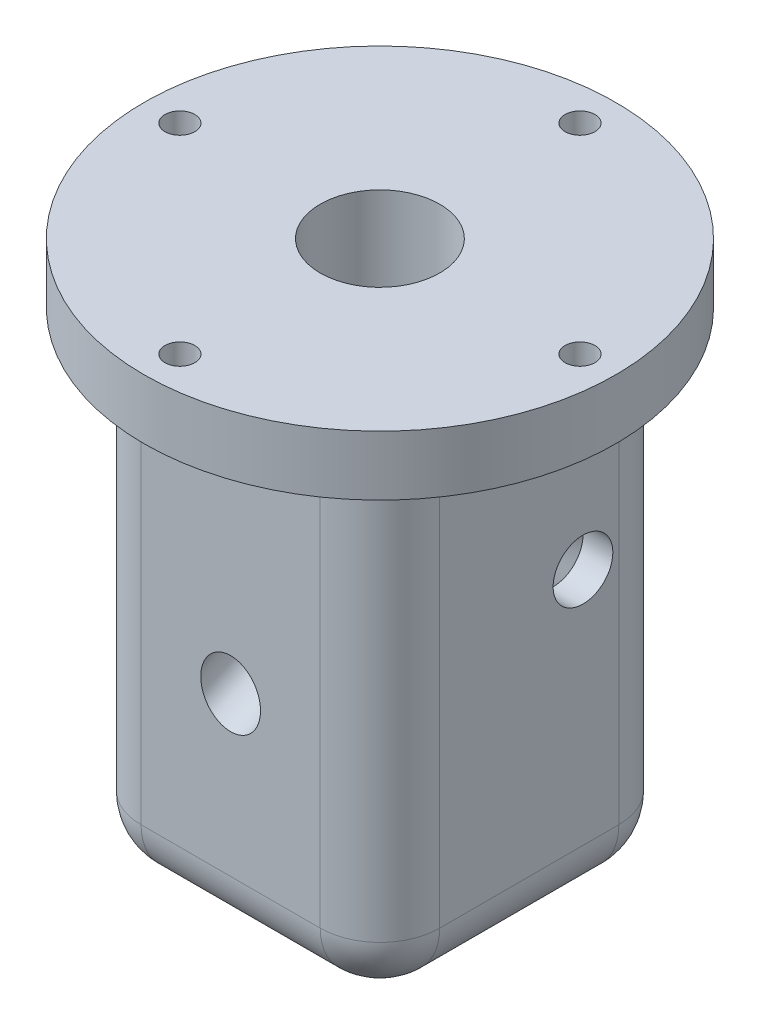
from build123d import *

# Parameters (mm, degrees)
SKETCH1_W                        = 31.75
SKETCH1_H                        = 31.75
STOCK_DEPTH                      = 50.8
SP_TAP_D                         = 12.7
SP_TAP_DEPTH                     = 33.02
SP_TAP_TIP                       = 3.815464931
F_47_START                       = -7.737817178
F_47_0_0785_GOX_ORFICE_OUTLINE_R = 0.99695
F_47_0_0785_GOX_ORFICE_DEPTH     = 11.439445718
F_65_0_035_DIAMETER_HOLE2_REACH  = 63.974
F_65_0_035_DIAMETER_HOLE2_BORE_R = 0.4445
SKETCH25_W                       = 31.75
SKETCH25_H                       = 31.75
BOSS_EXTRUDE1_DEPTH              = 6.35
M14_TAPPED_HOLE1_D               = 12
M14_TAPPED_HOLE1_DEPTH           = 19.05
M14_TAPPED_HOLE1_CSINK_D         = 14.05
M14_TAPPED_HOLE1_CSINK_ANGLE     = 90
M14_TAPPED_HOLE1_TIP             = 3.605163714
SKETCH30_R                       = 6.0198
CUT_EXTRUDE1_DEPTH               = 62.401577893
SKETCH31_R                       = 25.0825
SKETCH31_R_2                     = 1.5875
SKETCH31_W                       = 31.75
SKETCH31_H                       = 31.75
BOSS_EXTRUDE2_DEPTH              = 6.35
F_1_4_0_25_DIAMETER_HOLE1_D      = 6.35
F_1_4_0_25_DIAMETER_HOLE1_DEPTH  = 3.175
F_1_4_0_25_DIAMETER_HOLE1_TIP    = 1.907732465
FILLET2_R                        = 6.35
FILLET3_R                        = 6.35
FILLET4_R                        = 1.5875


# Read off the part's stored shape, not the designer's step: #47 (0.0785) GOx Orfice
with BuildPart() as part:
    # Sketch1 → Stock (new body)
    with BuildSketch(Plane(origin=(0, 0, 0), x_dir=(1, 0, 0), z_dir=(0, 1, 0))):
        Rectangle(SKETCH1_W, SKETCH1_H)
    extrude(amount=STOCK_DEPTH)

    # SP TAP
    with Locations(Plane(origin=(0, 50.8, 0), x_dir=(1, 0, 0), z_dir=(0, 1, 0))):
        with Locations((0, 0)):
            Hole(SP_TAP_D / 2, depth=SP_TAP_DEPTH)
            with Locations((0, 0, -(SP_TAP_DEPTH + SP_TAP_TIP / 2))):  # 118° drill point
                Cone(0, SP_TAP_D / 2, SP_TAP_TIP, mode=Mode.SUBTRACT)

    # #47 (0.0785) GOx Orfice outline → #47 (0.0785) GOx Orfice (cut)
    with BuildSketch(Plane(origin=(0, 0, 0), x_dir=(1, 0, 0), z_dir=(0, 0.42261826174069705, 0.9063077870366512)).offset(F_47_START)):
        with Locations((0, 21.96659786)):
            Circle(F_47_0_0785_GOX_ORFICE_OUTLINE_R)
    f_47_0_0785_gox_orfice = extrude(amount=F_47_0_0785_GOX_ORFICE_DEPTH, mode=Mode.SUBTRACT)

    # Second GOx Orfice: #47 (0.0785) GOx Orfice across plane
    add(f_47_0_0785_gox_orfice.mirror(Plane.XY), mode=Mode.SUBTRACT)

    # #65 (0.035) Diameter Hole2 bore → #65 (0.035) Diameter Hole2 (cut, up to next)
    with BuildSketch(Plane(origin=(15.875, 0, 0), x_dir=(0, 0, -1), z_dir=(1, 0, 0)), mode=Mode.PRIVATE) as f_65_0_035_diameter_hole2_sk1:
        with Locations((5.715, 25.4)):
            Circle(F_65_0_035_DIAMETER_HOLE2_BORE_R)
    f_65_0_035_diameter_hole2_tool1 = extrude(f_65_0_035_diameter_hole2_sk1.sketch, amount=-F_65_0_035_DIAMETER_HOLE2_REACH, mode=Mode.PRIVATE) & part.part
    add(f_65_0_035_diameter_hole2_tool1.solids().sort_by_distance((15.875, 25.4, -5.715))[0], mode=Mode.SUBTRACT)

    # Sketch25 → Boss-Extrude1 (add)
    with BuildSketch(Plane(origin=(0, 0, 0), x_dir=(-1, 0, 0), z_dir=(0, -1, 0))):
        Rectangle(SKETCH25_W, SKETCH25_H)
    extrude(amount=BOSS_EXTRUDE1_DEPTH)

    # M14 Tapped Hole1
    with Locations(Plane(origin=(0, -6.35, 0), x_dir=(-1, 0, 0), z_dir=(0, -1, 0))):
        with Locations((0, 0)):
            CounterSinkHole(M14_TAPPED_HOLE1_D / 2, M14_TAPPED_HOLE1_CSINK_D / 2, depth=M14_TAPPED_HOLE1_DEPTH, counter_sink_angle=M14_TAPPED_HOLE1_CSINK_ANGLE)
            with Locations((0, 0, -(M14_TAPPED_HOLE1_DEPTH + M14_TAPPED_HOLE1_TIP / 2))):  # 118° drill point
                Cone(0, M14_TAPPED_HOLE1_D / 2, M14_TAPPED_HOLE1_TIP, mode=Mode.SUBTRACT)

    # Sketch30 → Cut-Extrude1 (cut, through all)
    with BuildSketch(Plane(origin=(0, -6.35, 0), x_dir=(-1, 0, 0), z_dir=(0, -1, 0))):
        with Locations(Location((0, 0, 0), (0, 0, 90))):
            Circle(SKETCH30_R)
    extrude(amount=-CUT_EXTRUDE1_DEPTH, mode=Mode.SUBTRACT)

    # Sketch31 → Boss-Extrude2 (add)
    with BuildSketch(Plane(origin=(0, 50.8, 0), x_dir=(1, 0, 0), z_dir=(0, 1, 0))):
        with Locations(Location((0, 0, 0), (0, 0, 270))):
            Circle(SKETCH31_R)
        with Locations(Location((21.2725, 0, 0), (0, 0, 270))):
            Circle(SKETCH31_R_2, mode=Mode.SUBTRACT)
        with Locations(Location((0, -21.2725, 0), (0, 0, 270))):
            Circle(SKETCH31_R_2, mode=Mode.SUBTRACT)
        with Locations(Location((-21.2725, 0, 0), (0, 0, 270))):
            Circle(SKETCH31_R_2, mode=Mode.SUBTRACT)
        with Locations(Location((0, 21.2725, 0), (0, 0, 270))):
            Circle(SKETCH31_R_2, mode=Mode.SUBTRACT)
        Rectangle(SKETCH31_W, SKETCH31_H, mode=Mode.SUBTRACT)
    extrude(amount=-BOSS_EXTRUDE2_DEPTH)

    # 1/4 (0.25) Diameter Hole1
    with Locations(Plane(origin=(15.875, 0, 0), x_dir=(0, 0, -1), z_dir=(1, 0, 0))):
        with Locations((5.715, 25.4)):
            Hole(F_1_4_0_25_DIAMETER_HOLE1_D / 2, depth=F_1_4_0_25_DIAMETER_HOLE1_DEPTH)
            with Locations((0, 0, -(F_1_4_0_25_DIAMETER_HOLE1_DEPTH + F_1_4_0_25_DIAMETER_HOLE1_TIP / 2))):  # 118° drill point
                Cone(0, F_1_4_0_25_DIAMETER_HOLE1_D / 2, F_1_4_0_25_DIAMETER_HOLE1_TIP, mode=Mode.SUBTRACT)

    # Sketch35 → Cut-Revolve1 (revolve, cut)
    with BuildSketch(Plane(origin=(0, 0, 0), x_dir=(0, 0, -1), z_dir=(1, 0, 0)), mode=Mode.PRIVATE) as cut_revolve1_sk:
        Polygon((11.1125, 19.055615182), (11.499679808, 15.37184538), (19.76016519, 11.519917786), (21.101978171, 14.39744501), (15.875, 16.83482496), align=None)
    cut_revolve1 = revolve(cut_revolve1_sk.sketch.rotate(Axis((0, 16.83482496, -15.875), (0, 0.4226182617406968, 0.9063077870366512)), 180), axis=Axis((0, 16.83482496, -15.875), (0, 0.4226182617406968, 0.9063077870366512)), mode=Mode.SUBTRACT)

    # Mirror1: Cut-Revolve1 across plane
    add(cut_revolve1.mirror(Plane.XY), mode=Mode.SUBTRACT)

    # Fillet2
    fillet2_edges = [part.edges().sort_by_distance(p)[0] for p in [
        (-15.875, 19.05, 15.875),
        (15.875, 19.05, 15.875),
        (-15.875, 19.05, -15.875),
        (15.875, 19.05, -15.875),
    ]]
    fillet(fillet2_edges, radius=FILLET2_R)

    # Fillet3
    fillet3_edges = [part.edges().sort_by_distance(p)[0] for p in [
        (0, -6.35, 15.875),
        (15.875, -6.35, 0),
        (-15.875, -6.35, 0),
        (0, -6.35, -15.875),
        (-14.015128061, -6.35, -14.015128061),
        (14.015128061, -6.35, -14.015128061),
        (14.015128061, -6.35, 14.015128061),
        (-14.015128061, -6.35, 14.015128061),
    ]]
    fillet(fillet3_edges, radius=FILLET3_R)

    # Fillet4
    fillet4_edges = [part.edges().sort_by_distance(p)[0] for p in [
        (0, 44.45, 15.875),
        (-15.875, 44.45, 0),
        (15.875, 44.45, 0),
        (0, 44.45, -15.875),
        (-14.015128061, 44.45, 14.015128061),
        (14.015128061, 44.45, 14.015128061),
        (14.015128061, 44.45, -14.015128061),
        (-14.015128061, 44.45, -14.015128061),
    ]]
    fillet(fillet4_edges, radius=FILLET4_R)


solid = part.part
